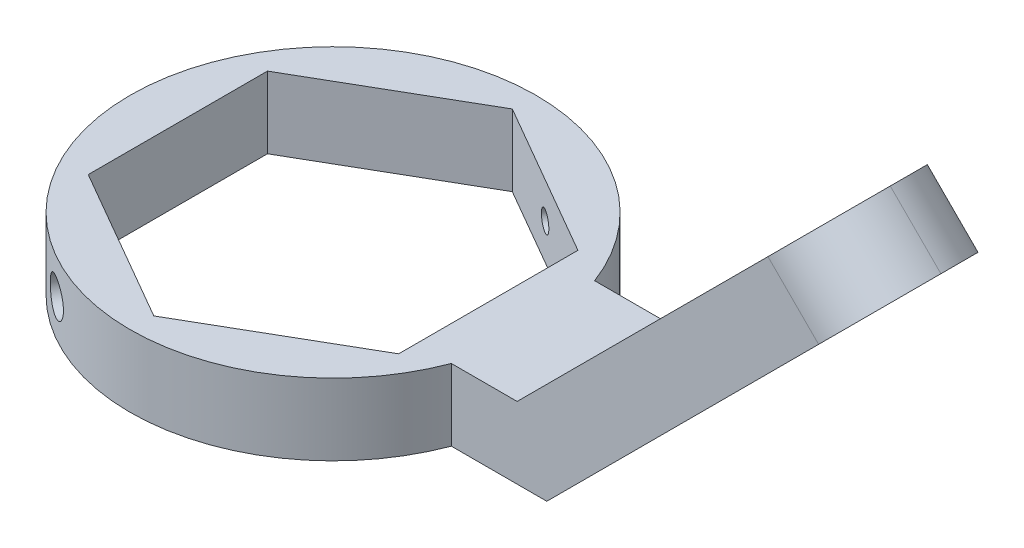
from build123d import *

# Parameters (mm, degrees)
BOSS_EXTRUDE1_DEPTH = 12
SKETCH4_W           = 76.386919113
SKETCH4_H           = 24
SKETCH4_R           = 4
BOSS_EXTRUDE2_DEPTH = 12
SKETCH4_3_R         = 8
SKETCH4_3_R_2       = 4
CUT_EXTRUDE1_DEPTH  = 5.15
FILLET1_R           = 12
SKETCH5_R           = 1.7
CUT_EXTRUDE2_DEPTH  = 123.426024465
CUT_EXTRUDE3_START  = -5
SKETCH5_3_R         = 3
CUT_EXTRUDE3_DEPTH  = 118.426024512


with BuildPart() as part:
    # Sketch3 → Boss-Extrude1 (new body)
    with BuildSketch(Plane(origin=(0, 0, 0), x_dir=(1, 0, 0), z_dir=(0, 1, 0))):
        with BuildLine():
            Line((-26, 15.011106999), (0, 30.022213998))
            Line((0, 30.022213998), (26, 15.011106999))
            Line((26, 15.011106999), (26, 12))
            Line((26, 12), (31.811947441, 12))
            ThreePointArc((31.811947441, 12), (-34, 0), (31.811947441, -12))
            Line((31.811947441, -12), (26, -12))
            Line((26, -12), (26, -15.011106999))
            Line((26, -15.011106999), (0, -30.022213998))
            Line((0, -30.022213998), (-26, -15.011106999))
            Line((-26, -15.011106999), (-26, 15.011106999))
        make_face()
        with BuildLine():
            Line((31.811947441, 12), (26, 12))
            Line((26, 12), (26, -12))
            Line((26, -12), (31.811947441, -12))
            ThreePointArc((31.811947441, -12), (33.448514264, -6.098925602), (34, 0))
            ThreePointArc((34, 0), (33.448514264, 6.098925602), (31.811947441, 12))
        make_face()
        with BuildLine():
            Line((47.8, 12), (31.811947441, 12))
            ThreePointArc((31.811947441, 12), (33.448514264, 6.098925602), (34, 0))
            ThreePointArc((34, 0), (33.448514264, -6.098925602), (31.811947441, -12))
            Line((31.811947441, -12), (47.8, -12))
            Line((47.8, -12), (47.8, 12))
        make_face()
    extrude(amount=BOSS_EXTRUDE1_DEPTH)

    # Sketch4 → Boss-Extrude2 (add)
    with BuildSketch(Plane(origin=(23.9, -23.9, 0), x_dir=(0.7071067811865462, 0.707106781186549, 0), z_dir=(0.707106781186549, -0.7071067811865462, 0))):
        with Locations((71.993163698, 0)):
            Rectangle(SKETCH4_W, SKETCH4_H)
        with Locations((94.186623254, 0)):
            Circle(SKETCH4_R, mode=Mode.SUBTRACT)
    extrude(amount=-BOSS_EXTRUDE2_DEPTH)

    # Sketch4<3> → Cut-Extrude1 (cut)
    with BuildSketch(Plane(origin=(23.9, -23.9, 0), x_dir=(0.7071067811865462, 0.707106781186549, 0), z_dir=(0.707106781186549, -0.7071067811865462, 0))):
        with Locations((94.186623254, 0)):
            Circle(SKETCH4_3_R)
        with Locations((94.186623254, 0)):
            Circle(SKETCH4_3_R_2, mode=Mode.SUBTRACT)
    extrude(amount=-CUT_EXTRUDE1_DEPTH, mode=Mode.SUBTRACT)

    # Fillet1
    fillet1_edges = [part.edges().sort_by_distance(p)[0] for p in [
        (97.571067812, 58.256349186, -12),
        (97.571067812, 58.256349186, 12),
    ]]
    fillet(fillet1_edges, radius=FILLET1_R - 0.0001)  # a hair under: the kernel refuses the full size

    # Sketch5 → Cut-Extrude2 (cut, through all)
    with BuildSketch(Plane(origin=(13, 0, -22.516660498), x_dir=(0.8660254037844415, 0, 0.4999999999999951), z_dir=(-0.49999999999999517, 0, 0.8660254037844416))):
        with Locations((0, 6)):
            Circle(SKETCH5_R)
    cut_extrude2 = extrude(amount=-CUT_EXTRUDE2_DEPTH, mode=Mode.SUBTRACT)

    # Sketch5<3> → Cut-Extrude3 (cut, through all)
    with BuildSketch(Plane(origin=(13, 0, -22.516660498), x_dir=(0.8660254037844415, 0, 0.4999999999999951), z_dir=(-0.49999999999999517, 0, 0.8660254037844416)).offset(CUT_EXTRUDE3_START)):
        with Locations((0, 6)):
            Circle(SKETCH5_3_R)
    cut_extrude3 = extrude(amount=-CUT_EXTRUDE3_DEPTH, mode=Mode.SUBTRACT)

    # Mirror1: Cut-Extrude2, Cut-Extrude3 across plane
    add(cut_extrude2.mirror(Plane(origin=(0, 0, 0), x_dir=(0.8660254037844415, 0, 0.49999999999999517), z_dir=(-0.49999999999999506, 0, 0.8660254037844415))), mode=Mode.SUBTRACT)
    add(cut_extrude3.mirror(Plane(origin=(0, 0, 0), x_dir=(0.8660254037844415, 0, 0.49999999999999517), z_dir=(-0.49999999999999506, 0, 0.8660254037844415))), mode=Mode.SUBTRACT)


solid = part.part
